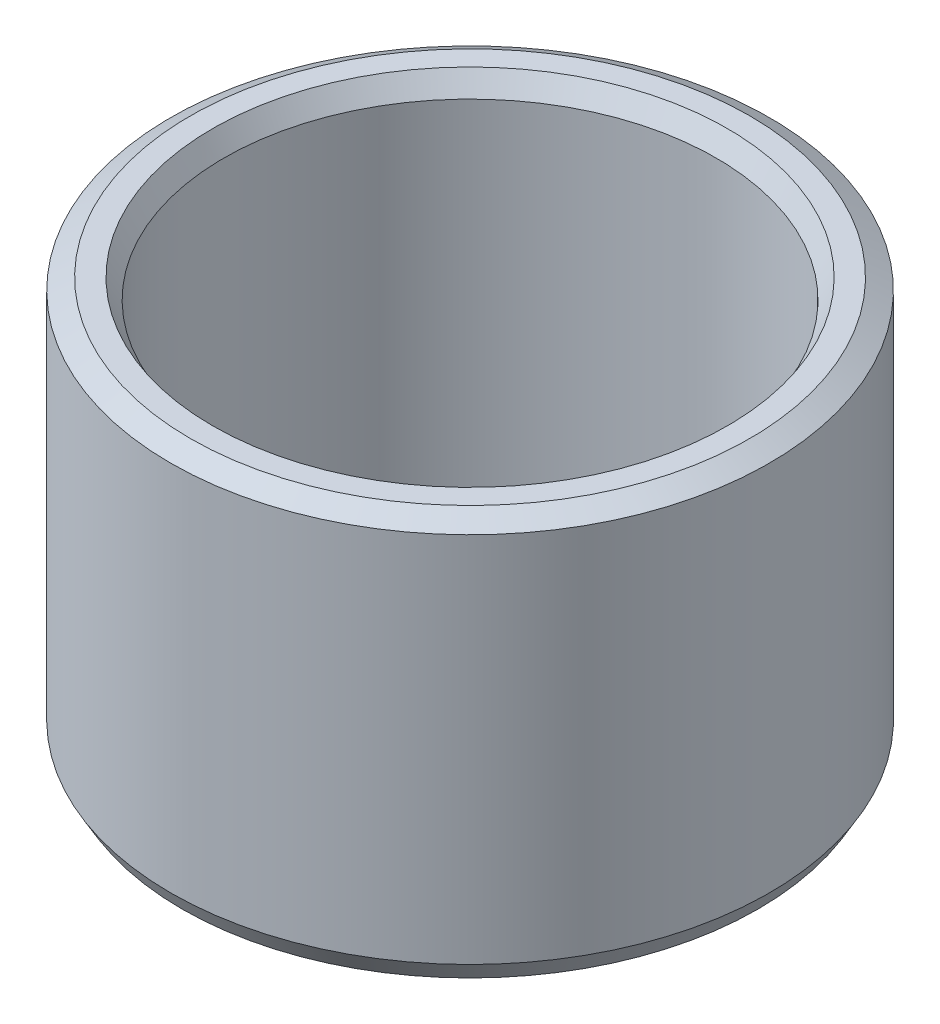
from build123d import *
from OCP.BRepFilletAPI import BRepFilletAPI_MakeChamfer

# Parameters (mm, degrees)
SKETCH1_R           = 50
BOSS_EXTRUDE1_DEPTH = 67.358770053
SKETCH2_R           = 41.097030867
CUT_EXTRUDE1_DEPTH  = 98.658608955
CHAMFER1_SIZE       = 1.90322601
CHAMFER1_SIZE2      = 3.296484148


with BuildPart() as part:
    # Sketch1 → Boss-Extrude1 (new body)
    with BuildSketch(Plane(origin=(0, 0, 0), x_dir=(1, 0, 0), z_dir=(0, 1, 0))):
        Circle(SKETCH1_R)
    extrude(amount=BOSS_EXTRUDE1_DEPTH)

    # Sketch2 → Cut-Extrude1 (cut, through all)
    with BuildSketch(Plane(origin=(0, 0, 0), x_dir=(1, 0, 0), z_dir=(0, 1, 0))):
        Circle(SKETCH2_R)
    extrude(amount=CUT_EXTRUDE1_DEPTH, mode=Mode.SUBTRACT)

    # Chamfer1: one chamfer whose edges measure the first distance from different faces: ONE call of the kernel's chamfer builder (chamfer() names one face for all edges)
    chamfer1_edges_1 = [part.edges().sort_by_distance(p)[0] for p in [
        (-41.097030867, 67.358770053, 0),
    ]]
    chamfer1_side_1 = [part.faces().sort_by_distance(p)[0] for p in [
        (-48.585786438, 67.358770053, 0),
    ]]
    chamfer1_edges_2 = [part.edges().sort_by_distance(p)[0] for p in [
        (-41.097030867, 0, 0),
    ]]
    chamfer1_side_2 = [part.faces().sort_by_distance(p)[0] for p in [
        (-41.097030867, 33.679385027, 0),
    ]]
    chamfer1_edges_3 = [part.edges().sort_by_distance(p)[0] for p in [
        (-50, 0, 0),
    ]]
    chamfer1_side_3 = [part.faces().sort_by_distance(p)[0] for p in [
        (-48.585786438, 0, 0),
    ]]
    chamfer1_edges_4 = [part.edges().sort_by_distance(p)[0] for p in [
        (-50, 67.358770053, 0),
    ]]
    chamfer1_side_4 = [part.faces().sort_by_distance(p)[0] for p in [
        (-50, 33.679385027, 0),
    ]]
    chamfer1 = BRepFilletAPI_MakeChamfer(part.part.solid().wrapped)
    for e in chamfer1_edges_1:
        chamfer1.Add(CHAMFER1_SIZE, CHAMFER1_SIZE2, e.wrapped, chamfer1_side_1[0].wrapped)  # the first distance lies on this face
    for e in chamfer1_edges_2:
        chamfer1.Add(CHAMFER1_SIZE, CHAMFER1_SIZE2, e.wrapped, chamfer1_side_2[0].wrapped)  # the first distance lies on this face
    for e in chamfer1_edges_3:
        chamfer1.Add(CHAMFER1_SIZE, CHAMFER1_SIZE2, e.wrapped, chamfer1_side_3[0].wrapped)  # the first distance lies on this face
    for e in chamfer1_edges_4:
        chamfer1.Add(CHAMFER1_SIZE, CHAMFER1_SIZE2, e.wrapped, chamfer1_side_4[0].wrapped)  # the first distance lies on this face
    add(Compound.cast(chamfer1.Shape()), mode=Mode.REPLACE)


solid = part.part
